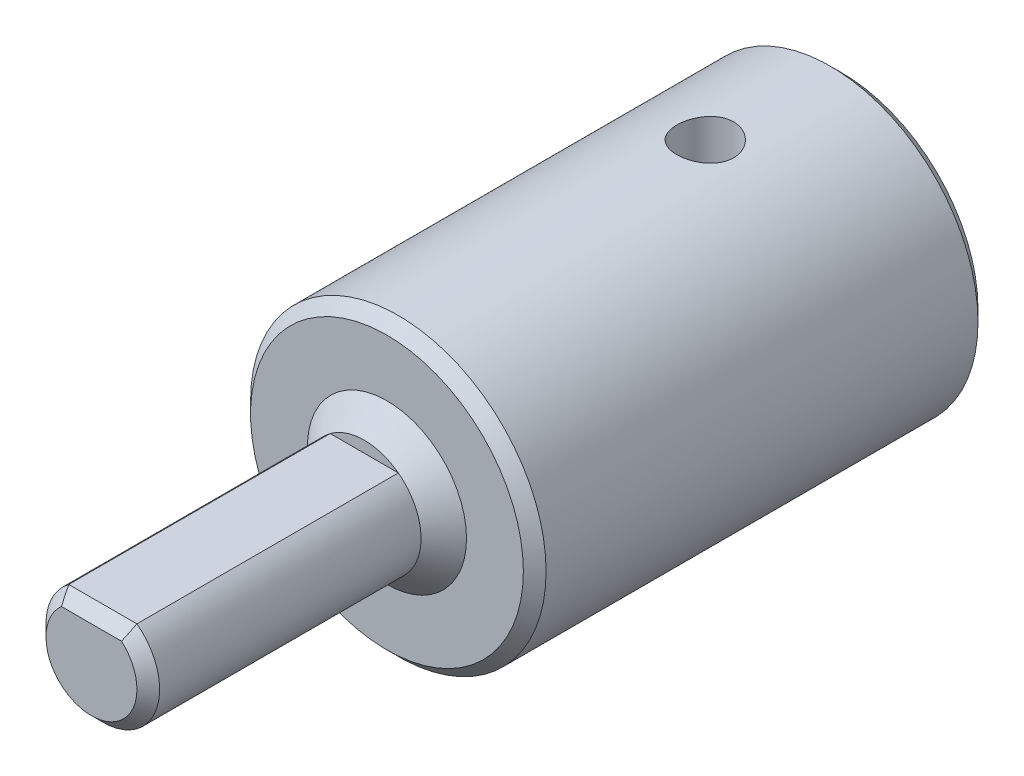
from build123d import *

# Parameters (mm, degrees)
SKETCH_1_R          = 6.5
EXTRUDE_1_DEPTH     = 20
CUT_EXTRUDE_1_DEPTH = 17
SKETCH_3_R          = 2.5
EXTRUDE_2_DEPTH     = 13
CUT_EXTRUDE_START   = -12
CUT_EXTRUDE_2_DEPTH = 12
CHAMFER_1_SIZE      = 1
CUT_EXTRUDE_3_DEPTH = 17
CHAMFER_2_SIZE      = 0.5
CHAMFER_3_SIZE      = 0.5
SKETCH_6_R          = 1.25
CUT_EXTRUDE_4_DEPTH = 10


with BuildPart() as part:
    # 草图1 → 凸台-拉伸1 (new body)
    with BuildSketch(Plane.XY):
        Circle(SKETCH_1_R)
    extrude(amount=EXTRUDE_1_DEPTH)

    # 草图2 → 切除-拉伸1 (cut)
    with BuildSketch(Plane(origin=(0, 0, 0), x_dir=(-1, 0, 0), z_dir=(0, 0, -1))):
        with BuildLine():
            Line((3.122498999, 2.5), (-3.122498999, 2.5))
            ThreePointArc((-3.122498999, 2.5), (-3.605551275, -1.732050808), (0, -4))
            ThreePointArc((0, -4), (2.828427125, -2.828427125), (4, 0))
            ThreePointArc((4, 0), (3.774254628, 1.324764885), (3.122498999, 2.5))
        make_face()
    extrude(amount=-CUT_EXTRUDE_1_DEPTH, mode=Mode.SUBTRACT)

    # 草图3 → 凸台-拉伸2 (add)
    with BuildSketch(Plane.XY.offset(20)):
        with Locations(Location((0, 0, 0), (0, 0, 180))):
            Circle(SKETCH_3_R)
    extrude(amount=EXTRUDE_2_DEPTH)

    # 草图4 → 切除-拉伸2 (cut)
    with BuildSketch(Plane.XY.offset(33).offset(CUT_EXTRUDE_START)):
        with BuildLine():
            Line((-1.5, 2), (1.5, 2))
            ThreePointArc((1.5, 2), (0, 2.5), (-1.5, 2))
        make_face()
    extrude(amount=CUT_EXTRUDE_2_DEPTH, mode=Mode.SUBTRACT)

    # 倒角1
    chamfer_1_edges = [part.edges().sort_by_distance(p)[0] for p in [
        (2.5, 0, 20),
    ]]
    chamfer(chamfer_1_edges, length=CHAMFER_1_SIZE - 0.0001)  # a hair under: the kernel refuses the full size

    # 草图5 → 切除-拉伸3 (cut)
    with BuildSketch(Plane(origin=(0, 0, 0), x_dir=(-1, 0, 0), z_dir=(0, 0, -1))):
        with BuildLine():
            Line((3.170173497, 2.6), (-3.170173497, 2.6))
            ThreePointArc((-3.170173497, 2.6), (0, -4.1), (3.170173497, 2.6))
        make_face()
    extrude(amount=-CUT_EXTRUDE_3_DEPTH, mode=Mode.SUBTRACT)

    # 倒角2
    chamfer_2_edges = [part.edges().sort_by_distance(p)[0] for p in [
        (1.118033989, -2.236067977, 33),
        (0, 2, 33),
    ]]
    chamfer(chamfer_2_edges, length=CHAMFER_2_SIZE - 0.0001)  # a hair under: the kernel refuses the full size

    # 倒角3
    chamfer_3_edges = [part.edges().sort_by_distance(p)[0] for p in [
        (-6.5, 0, 0),
        (0, -4.1, 0),
        (0, 2.6, 0),
        (-6.5, 0, 20),
    ]]
    chamfer(chamfer_3_edges, length=CHAMFER_3_SIZE)

    # 草图6 → 切除-拉伸4 (cut)
    with BuildSketch(Plane(origin=(0, 0, 0), x_dir=(1, 0, 0), z_dir=(0, 1, 0))):
        with Locations(Location((0, -6, 0), (0, 0, 90))):
            Circle(SKETCH_6_R)
    extrude(amount=CUT_EXTRUDE_4_DEPTH, mode=Mode.SUBTRACT)


solid = part.part
